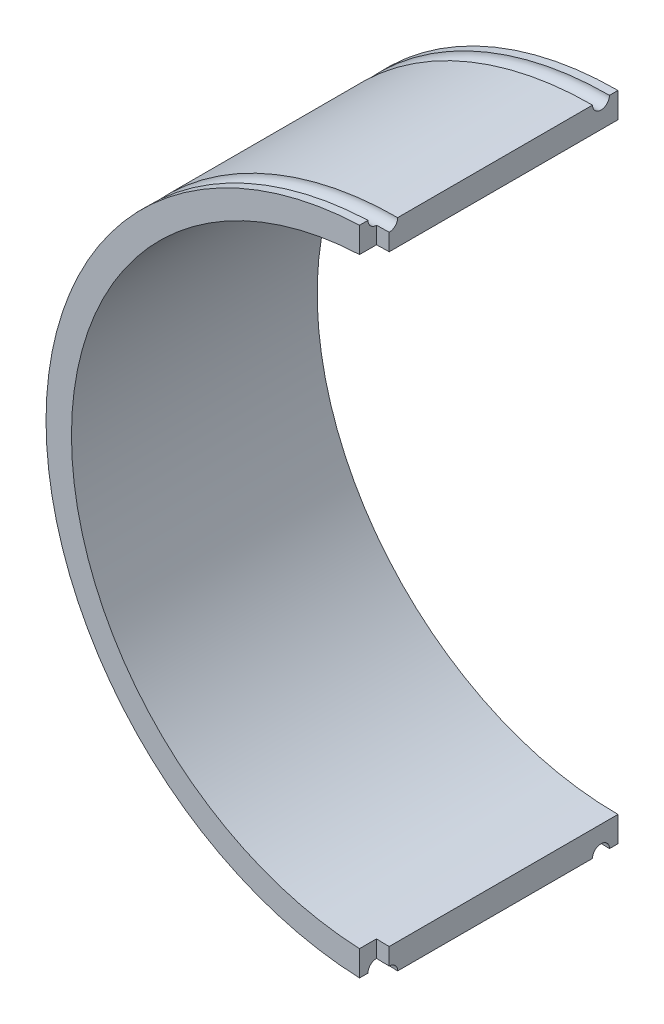
from build123d import *

# Parameters (mm, degrees)
MAIN_SHELL_DEPTH = 29
END_START        = -2
END_STOP_DEPTH   = 2


with BuildPart() as part:
    # Sketch1 → Main Shell (new body)
    with BuildSketch(Plane.XY):
        with BuildLine():
            Line((0, 38.5), (0, 35.5))
            ThreePointArc((0, 35.5), (-35.5, 0), (0, -35.5))
            Line((0, -35.5), (0, -38.5))
            ThreePointArc((0, -38.5), (-38.5, 0), (0, 38.5))
        make_face()
    extrude(amount=MAIN_SHELL_DEPTH)

    # Sketch3 → Rubber Band Holder (revolve, cut)
    with BuildSketch(Plane(origin=(0, 0, 0), x_dir=(0, 0, -1), z_dir=(1, 0, 0))):
        with BuildLine():
            Line((-28, 38.5), (-26, 38.5))
            ThreePointArc((-26, 38.5), (-27, 37.5), (-28, 38.5))
        make_face()
        with BuildLine():
            Line((-3, 38.5), (-1, 38.5))
            ThreePointArc((-1, 38.5), (-2, 37.5), (-3, 38.5))
        make_face()
    revolve(axis=Axis((0, 0, 29), (0, 0, -1)), mode=Mode.SUBTRACT)

    # Sketch4 → End Stop (cut)
    with BuildSketch(Plane.XY.offset(29).offset(END_START)):
        with BuildLine():
            Line((0, 35.5), (0, 38.5))
            ThreePointArc((0, 38.5), (-0.750142404, 38.492691337), (-1.5, 38.470768123))
            Line((-1.5, 38.470768123), (-1.5, 35.468295702))
            ThreePointArc((-1.5, 35.468295702), (-0.750167508, 35.49207304), (0, 35.5))
        make_face()
        with BuildLine():
            Line((-1.5, -35.468295702), (-1.5, -38.470768123))
            ThreePointArc((-1.5, -38.470768123), (-0.750142404, -38.492691337), (0, -38.5))
            Line((0, -38.5), (0, -35.5))
            ThreePointArc((0, -35.5), (-0.750167508, -35.49207304), (-1.5, -35.468295702))
        make_face()
    extrude(amount=END_STOP_DEPTH, mode=Mode.SUBTRACT)


solid = part.part
